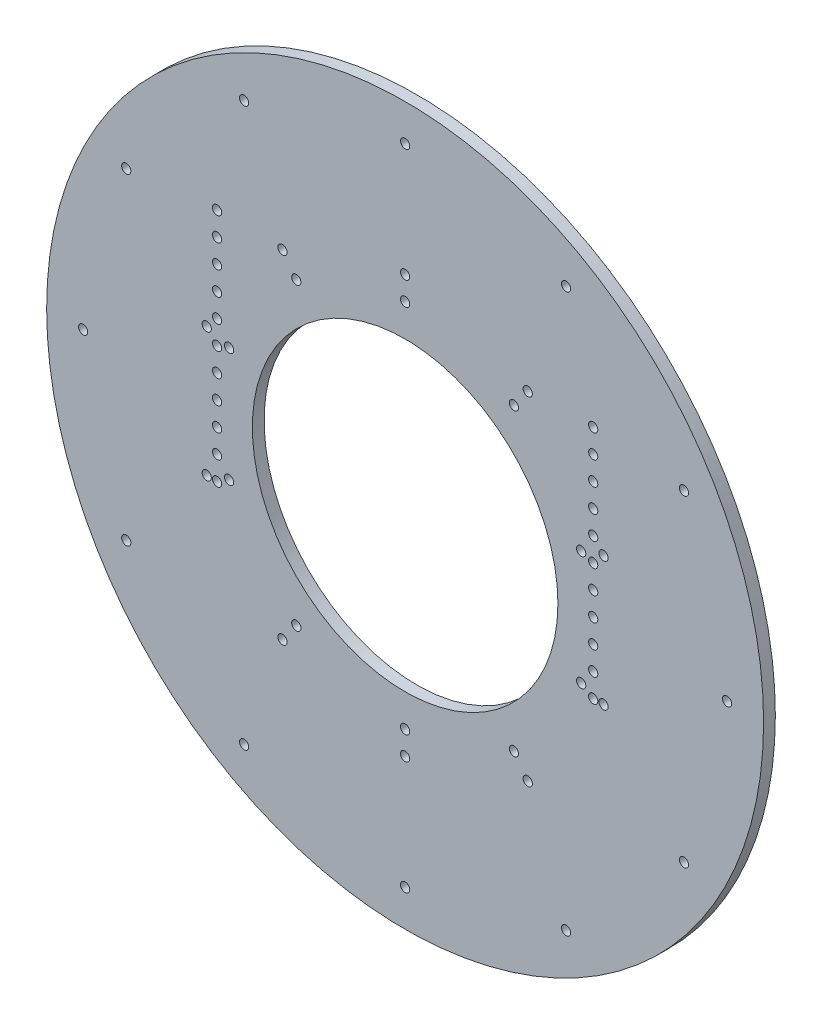
from build123d import *

# Parameters (mm, degrees)
SKETCH1_R                          = 193.675
BOSS_EXTRUDE1_DEPTH                = 6.35
F_9_0_196_DIAMETER_HOLE1_D         = 4.9784
SKETCH5_R                          = 82.55
CUT_EXTRUDE1_DEPTH                 = 6.35
F_9_0_196_DIAMETER_HOLE2_D         = 4.9784
F_9_0_196_DIAMETER_HOLE3_OUTLINE_R = 2.4892
F_9_0_196_DIAMETER_HOLE3_DEPTH     = 6.35


# Read off the part's stored shape, not the designer's step: #9 (0.196) Diameter Hole3
with BuildPart() as part:
    # Sketch1 → Boss-Extrude1 (new body)
    with BuildSketch(Plane(origin=(0, 0, 0), x_dir=(0, 1, 0), z_dir=(0, 0, 1))):
        with Locations(Location((0, 0, 0), (0, 0, 270))):
            Circle(SKETCH1_R)
    extrude(amount=BOSS_EXTRUDE1_DEPTH)

    # #9 (0.196) Diameter Hole1 (through all)
    with Locations(Plane.XY.offset(6.35)):
        with Locations((-150.657762959, 86.9823), (-173.9646, 0), (-150.657762959, -86.9823), (-86.9823, -150.657762959), (0, -173.9646), (86.9823, -150.657762959), (150.657762959, -86.9823), (173.9646, 0), (150.657762959, 86.9823), (86.9823, 150.657762959), (0, 173.9646), (-86.9823, 150.657762959)):
            Hole(F_9_0_196_DIAMETER_HOLE1_D / 2)

    # Sketch5 → Cut-Extrude1 (cut)
    with BuildSketch(Plane.XY.offset(6.35)):
        Circle(SKETCH5_R)
    extrude(amount=-CUT_EXTRUDE1_DEPTH, mode=Mode.SUBTRACT)

    # #9 (0.196) Diameter Hole2 (through all)
    with Locations(Plane.XY.offset(6.35)):
        with Locations((101.6, 92.075), (101.6, 79.375), (101.6, 66.675), (101.6, 53.975), (101.6, 41.275), (101.6, 28.575), (101.6, 15.875), (101.6, 3.175), (101.6, -9.525), (101.6, -22.225), (101.6, -34.925), (-101.6, 92.075), (-101.6, 79.375), (-101.6, 66.675), (-101.6, 53.975), (-101.6, 41.275), (-101.6, 28.575), (-101.6, 15.875), (-101.6, 3.175), (-101.6, -9.525), (-101.6, -22.225), (-101.6, -34.925)):
            Hole(F_9_0_196_DIAMETER_HOLE2_D / 2)

    # #9 (0.196) Diameter Hole3 outline → #9 (0.196) Diameter Hole3 (cut)
    with BuildSketch(Plane.XY):
        with Locations((66.250745249, -91.186327978)):
            Circle(F_9_0_196_DIAMETER_HOLE3_OUTLINE_R)
        with Locations((58.785872545, -80.91181215)):
            Circle(F_9_0_196_DIAMETER_HOLE3_OUTLINE_R)
        with Locations((107.195957593, -34.830077978)):
            Circle(F_9_0_196_DIAMETER_HOLE3_OUTLINE_R)
        with Locations((95.117539836, -30.90556215)):
            Circle(F_9_0_196_DIAMETER_HOLE3_OUTLINE_R)
        with Locations((107.195957593, 34.830077978)):
            Circle(F_9_0_196_DIAMETER_HOLE3_OUTLINE_R)
        with Locations((95.117539836, 30.90556215)):
            Circle(F_9_0_196_DIAMETER_HOLE3_OUTLINE_R)
        with Locations((66.250745249, 91.186327978)):
            Circle(F_9_0_196_DIAMETER_HOLE3_OUTLINE_R)
        with Locations((58.785872545, 80.91181215)):
            Circle(F_9_0_196_DIAMETER_HOLE3_OUTLINE_R)
        with Locations((0, 112.7125)):
            Circle(F_9_0_196_DIAMETER_HOLE3_OUTLINE_R)
        with Locations((0, 100.0125)):
            Circle(F_9_0_196_DIAMETER_HOLE3_OUTLINE_R)
        with Locations((-66.250745249, 91.186327978)):
            Circle(F_9_0_196_DIAMETER_HOLE3_OUTLINE_R)
        with Locations((-58.785872545, 80.91181215)):
            Circle(F_9_0_196_DIAMETER_HOLE3_OUTLINE_R)
        with Locations((-107.195957593, 34.830077978)):
            Circle(F_9_0_196_DIAMETER_HOLE3_OUTLINE_R)
        with Locations((-95.117539836, 30.90556215)):
            Circle(F_9_0_196_DIAMETER_HOLE3_OUTLINE_R)
        with Locations((-107.195957593, -34.830077978)):
            Circle(F_9_0_196_DIAMETER_HOLE3_OUTLINE_R)
        with Locations((-95.117539836, -30.90556215)):
            Circle(F_9_0_196_DIAMETER_HOLE3_OUTLINE_R)
        with Locations((-66.250745249, -91.186327978)):
            Circle(F_9_0_196_DIAMETER_HOLE3_OUTLINE_R)
        with Locations((-58.785872545, -80.91181215)):
            Circle(F_9_0_196_DIAMETER_HOLE3_OUTLINE_R)
        with Locations((0, -112.7125)):
            Circle(F_9_0_196_DIAMETER_HOLE3_OUTLINE_R)
        with Locations((0, -100.0125)):
            Circle(F_9_0_196_DIAMETER_HOLE3_OUTLINE_R)
    extrude(amount=F_9_0_196_DIAMETER_HOLE3_DEPTH, mode=Mode.SUBTRACT)


solid = part.part
